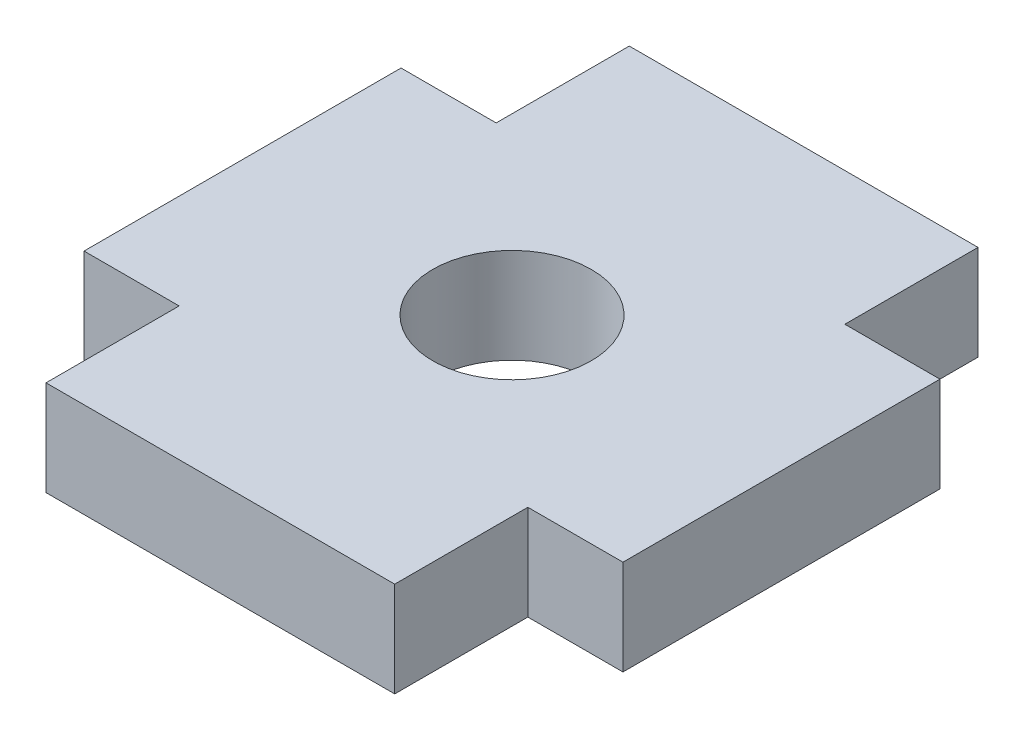
from build123d import *

# Parameters (mm, degrees)
ESBO_O1_R                = 2.5
RESSALTO_EXTRUS_O1_DEPTH = 3


with BuildPart() as part:
    # Esboço1 → Ressalto-extrusão1 (new body)
    with BuildSketch(Plane.XZ.offset(-10)):
        Polygon((-65.5, -9.199919627), (-65.5, -5), (-62.5, -5), (-62.5, 5), (-65.5, 5), (-65.5, 9.199919627), (-76.5, 9.199919627), (-76.5, 5), (-79.5, 5), (-79.5, -5), (-76.5, -5), (-76.5, -9.199919627), align=None)
        with Locations((-71, 0)):
            Circle(ESBO_O1_R, mode=Mode.SUBTRACT)
    extrude(amount=-RESSALTO_EXTRUS_O1_DEPTH)


solid = part.part
